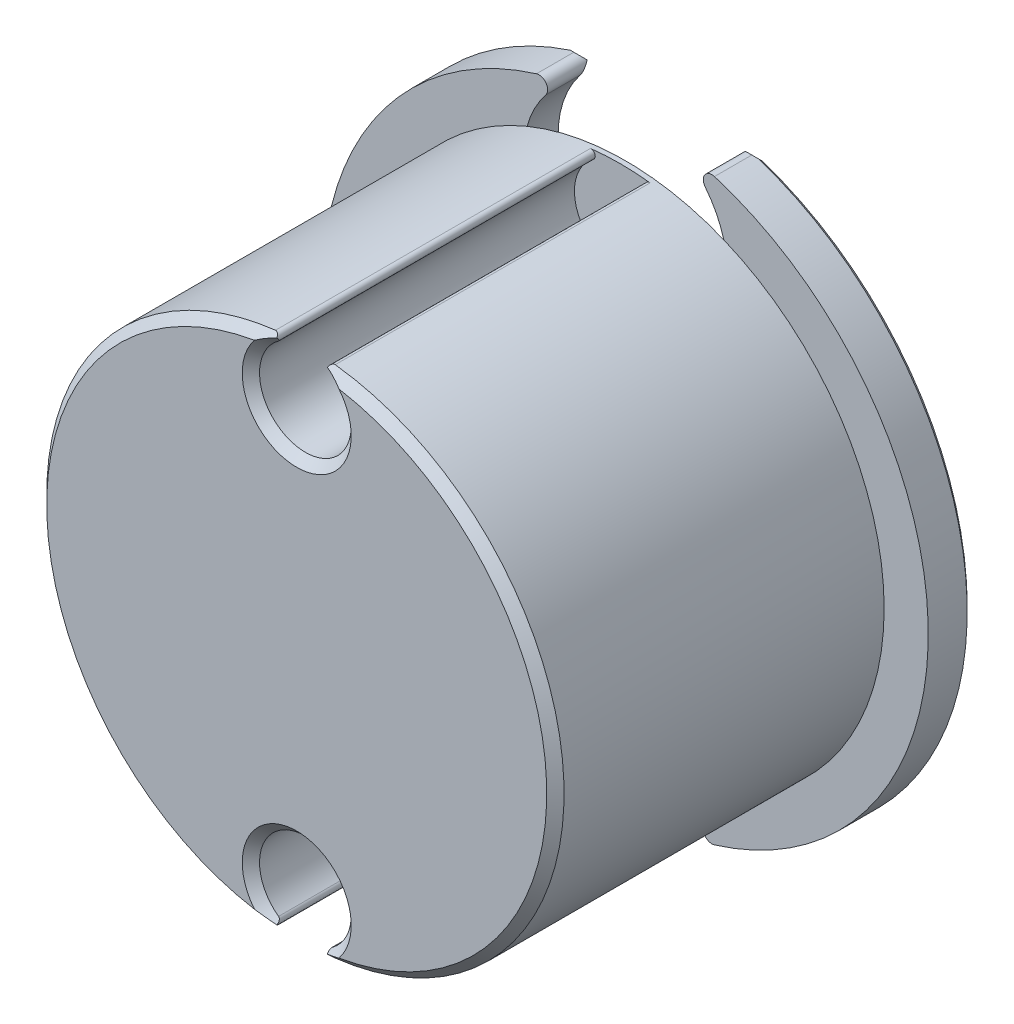
from build123d import *
from build123d.topology import SkipClean

# Parameters (mm, degrees)
BOSS_EXTRUDE1_DEPTH     = 19
FILLET2_R               = 0.25
BOSS_EXTRUDE2_START     = 2.5
SKETCH3_R               = 17.5
SKETCH3_R_2             = 2.65
BOSS_EXTRUDE2_DEPTH     = 2.5
SKETCH4_R               = 5.9
CUT_EXTRUDE1_DEPTH      = 2.5
FILLET1_R               = 0.5
CUT_EXTRUDE2_DEPTH      = 31.786064168
CUT_EXTRUDE2_DEPTH_BACK = 31.786064168
BOSS_EXTRUDE3_DEPTH     = 0.3
CHAMFER1_SIZE           = 0.25
CHAMFER2_SIZE           = 0.5


with BuildPart() as part:
    # Sketch2 → Boss-Extrude1 (new body)
    with BuildSketch(Plane.XY):
        with BuildLine():
            ThreePointArc((-0.480352472, 14.942281001), (-14.95, 0), (-0.480352472, -14.942281001))
            ThreePointArc((-0.480352472, -14.942281001), (-0.308693392, -14.933464362), (-0.140884454, -14.896252363))
            ThreePointArc((-0.140884454, -14.896252363), (0, -9.6), (0.140884454, -14.896252363))
            ThreePointArc((0.140884454, -14.896252363), (0.308693392, -14.933464362), (0.480352472, -14.942281001))
            ThreePointArc((0.480352472, -14.942281001), (14.95, 0), (0.480352472, 14.942281001))
            ThreePointArc((0.480352472, 14.942281001), (0.308693392, 14.933464362), (0.140884454, 14.896252363))
            ThreePointArc((0.140884454, 14.896252363), (0, 9.6), (-0.140884454, 14.896252363))
            ThreePointArc((-0.140884454, 14.896252363), (-0.308693392, 14.933464362), (-0.480352472, 14.942281001))
        make_face()
    extrude(amount=BOSS_EXTRUDE1_DEPTH)

    # Fillet2
    fillet2_edges = [part.edges().sort_by_distance(p)[0] for p in [
        (0.140884454, 14.896252363, 9.5),
        (-0.140884454, 14.896252363, 9.5),
        (0.140884454, -14.896252363, 9.5),
        (-0.140884454, -14.896252363, 9.5),
    ]]
    fillet(fillet2_edges, radius=FILLET2_R)

    # Sketch3 → Boss-Extrude2 (add)
    with BuildSketch(Plane(origin=(0, 0, 0), x_dir=(-1, 0, 0), z_dir=(0, 0, -1)).offset(BOSS_EXTRUDE2_START)):
        Circle(SKETCH3_R)
        with Locations((0, 12.25)):
            Circle(SKETCH3_R_2, mode=Mode.SUBTRACT)
        with Locations((0, -12.25)):
            Circle(SKETCH3_R_2, mode=Mode.SUBTRACT)
    extrude(amount=-BOSS_EXTRUDE2_DEPTH)

    # Sketch4 → Cut-Extrude1 (cut)
    with BuildSketch(Plane(origin=(0, 0, -2.5), x_dir=(-1, 0, 0), z_dir=(0, 0, -1))):
        with Locations((0, 12.25)):
            Circle(SKETCH4_R)
        with Locations((0, -12.25)):
            Circle(SKETCH4_R)
    extrude(amount=-CUT_EXTRUDE1_DEPTH, mode=Mode.SUBTRACT)

    # Fillet1
    fillet1_edges = [part.edges().sort_by_distance(p)[0] for p in [
        (-3.204069932, -17.204183673, -1.25),
        (3.204069932, -17.204183673, -1.25),
        (3.204069932, 17.204183673, -1.25),
        (-3.204069932, 17.204183673, -1.25),
    ]]
    fillet(fillet1_edges, radius=FILLET1_R)

    # Sketch6 → Cut-Extrude2 (cut, two sides: drawn at the far end of the back side and taken through both)
    with BuildSketch(Plane(origin=(0, 0, 0), x_dir=(0, 0, -1), z_dir=(1, 0, 0)).offset(-CUT_EXTRUDE2_DEPTH_BACK)):
        Polygon((2.5, 16.384756954), (1.839011593, 17.045745361), (2.5, 17.045745361), align=None)
        Polygon((2.5, -17.045745361), (1.839011593, -17.045745361), (2.5, -16.384756954), align=None)
    extrude(amount=CUT_EXTRUDE2_DEPTH + CUT_EXTRUDE2_DEPTH_BACK, mode=Mode.SUBTRACT)

    # Sketch5 → Boss-Extrude3 (add)
    with SkipClean():  # the faces are left unmerged after this step: merging them gives an invalid solid
        with BuildSketch(Plane(origin=(0, 0, 0), x_dir=(-1, 0, 0), z_dir=(0, 0, -1))):
            with BuildLine():
                Line((1.725721181, 14.850063515), (3.599704445, 11.66813084))
                Line((3.599704445, 11.66813084), (0.332481581, 8.719914622))
                Line((0.332481581, 8.719914622), (-3.586502444, 11.083425606))
                Line((-3.586502444, 11.083425606), (-1.725721181, 14.850063515))
                ThreePointArc((-1.725721181, 14.850063515), (0, 14.95), (1.725721181, 14.850063515))
            make_face()
            with BuildLine():
                Line((-3.586502444, -11.083425606), (-1.725721181, -14.850063515))
                ThreePointArc((-1.725721181, -14.850063515), (0, -14.95), (1.725721181, -14.850063515))
                Line((1.725721181, -14.850063515), (3.599704445, -11.66813084))
                Line((3.599704445, -11.66813084), (0.332481581, -8.719914622))
                Line((0.332481581, -8.719914622), (-3.586502444, -11.083425606))
            make_face()
        extrude(amount=-BOSS_EXTRUDE3_DEPTH)

    # Chamfer1
    chamfer1_edges = [part.edges().sort_by_distance(p)[0] for p in [
        (-17.5, 0, -2.5),
        (17.5, 0, -2.5),
    ]]
    chamfer(chamfer1_edges, length=CHAMFER1_SIZE)

    # Chamfer2
    # the kernel refuses this chamfer: 0.5 mm, written as the material it takes off along each edge
    with BuildSketch(Plane(origin=(0, -12.25, -2.5), x_dir=(0.6266072217186398, -0.7793352229240299, 0), z_dir=(-0.7793352229240299, -0.6266072217186398, 0))) as chamfer2_piece_1:
        Polygon((5.9 + CHAMFER2_SIZE, 0), (5.9, CHAMFER2_SIZE), (5.9, 0), align=None)
    revolve(axis=Axis((0, -12.25, -2.5), (0, 0, 1)), revolution_arc=282.399498551, mode=Mode.SUBTRACT)
    with BuildSketch(Plane(origin=(0, 12.25, -2.5), x_dir=(0.6266072217186399, 0.7793352229240298, 0), z_dir=(-0.7793352229240298, 0.6266072217186399, 0))) as chamfer2_piece_2:
        Polygon((5.9 + CHAMFER2_SIZE, 0), (5.9, -CHAMFER2_SIZE), (5.9, 0), align=None)
    revolve(axis=Axis((0, 12.25, -2.5), (0, 0, -1)), revolution_arc=282.399498551, mode=Mode.SUBTRACT)
    with BuildSketch(Plane(origin=(0, -12.25, 19), x_dir=(-0.13736903442789797, -0.990519938406263, 0), z_dir=(0.990519938406263, -0.13736903442789797, 0))) as chamfer2_piece_3:
        Polygon((2.65 + CHAMFER2_SIZE, 0), (2.65, CHAMFER2_SIZE), (2.65, 0), align=None)
    revolve(axis=Axis((0, -12.25, 19), (0, 0, -1)), revolution_arc=344.208735855, mode=Mode.SUBTRACT)
    with BuildSketch(Plane(origin=(0, 12.25, 19), x_dir=(0.13736903442790002, 0.9905199384062627, 0), z_dir=(-0.9905199384062627, 0.13736903442790002, 0))) as chamfer2_piece_4:
        Polygon((2.65 + CHAMFER2_SIZE, 0), (2.65, CHAMFER2_SIZE), (2.65, 0), align=None)
    revolve(axis=Axis((0, 12.25, 19), (0, 0, -1)), revolution_arc=344.208735855, mode=Mode.SUBTRACT)
    with BuildSketch(Plane(origin=(0, 0, 19), x_dir=(-0.02955831012305068, 0.9995630576920446, 0), z_dir=(0.9995630576920446, 0.02955831012305068, 0))) as chamfer2_piece_5:
        Polygon((14.95 - CHAMFER2_SIZE, 0), (14.95, -CHAMFER2_SIZE), (14.95, 0), align=None)
    revolve(axis=Axis((0, 0, 19), (0, 0, 1)), revolution_arc=176.612373747, mode=Mode.SUBTRACT)
    with BuildSketch(Plane(origin=(0, 0, 19), x_dir=(0.029558310123051157, -0.9995630576920446, 0), z_dir=(-0.9995630576920446, -0.029558310123051157, 0))) as chamfer2_piece_6:
        Polygon((14.95, -CHAMFER2_SIZE), (14.95 - CHAMFER2_SIZE, 0), (14.95, 0), align=None)
    revolve(axis=Axis((0, 0, 19), (0, 0, 1)), revolution_arc=176.612373747, mode=Mode.SUBTRACT)


solid = part.part
